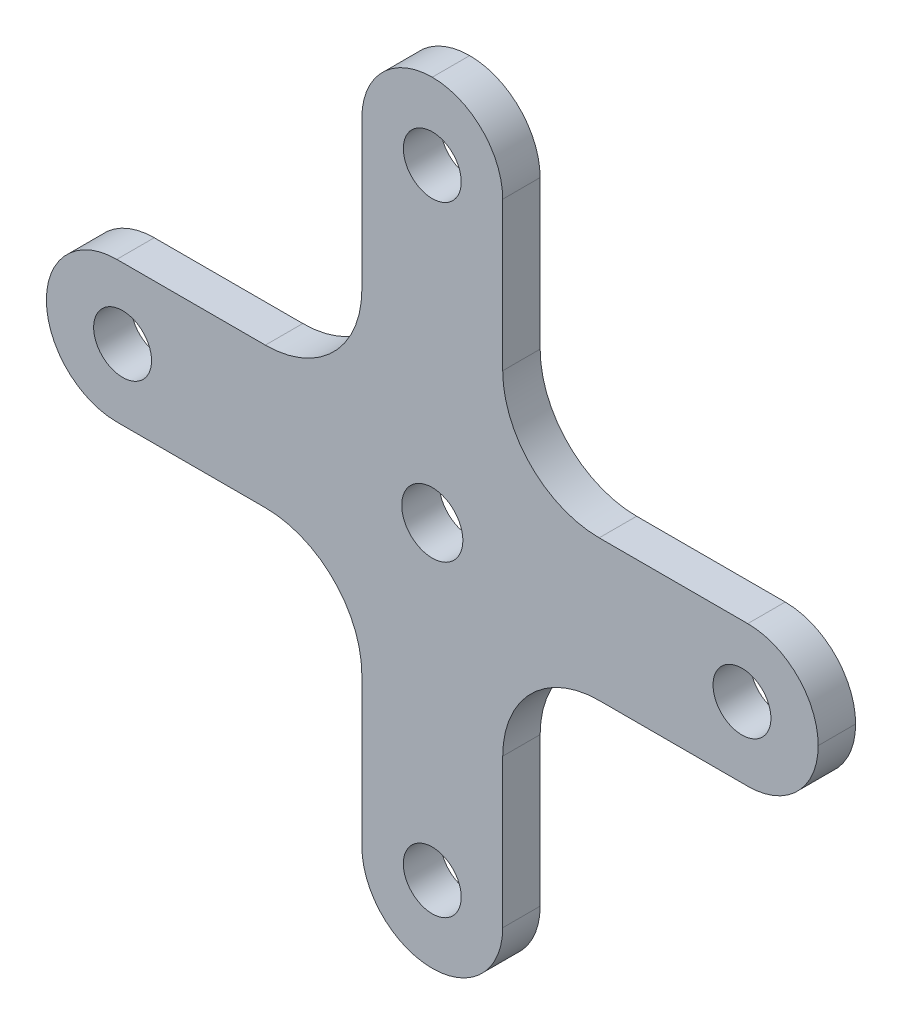
from build123d import *

# Parameters (mm, degrees)
SKETCH2_R           = 1.5
BOSS_EXTRUDE1_DEPTH = 0.97
FILLET1_R           = 3.65
FILLET2_R           = 5
SKETCH3_R           = 1.585
CUT_EXTRUDE1_DEPTH  = 29.350724858


with BuildPart() as part:
    # Sketch2 → Boss-Extrude1 (new, symmetric)
    with BuildSketch(Plane.XY):
        Polygon((-3.65, -3.65), (-3.65, -20), (3.65, -20), (3.65, -3.65), (20, -3.65), (20, 3.65), (3.65, 3.65), (3.65, 20), (-3.65, 20), (-3.65, 3.65), (-20, 3.65), (-20, -3.65), align=None)
        with Locations((-16.05, 0)):
            Circle(SKETCH2_R, mode=Mode.SUBTRACT)
        with Locations((0, -16.05)):
            Circle(SKETCH2_R, mode=Mode.SUBTRACT)
        with Locations((16.05, 0)):
            Circle(SKETCH2_R, mode=Mode.SUBTRACT)
        with Locations((0, 16.05)):
            Circle(SKETCH2_R, mode=Mode.SUBTRACT)
    extrude(amount=BOSS_EXTRUDE1_DEPTH, both=True)

    # Fillet1
    fillet1_edges = [part.edges().sort_by_distance(p)[0] for p in [
        (20, 3.65, 0),
        (20, -3.65, 0),
        (3.65, -20, 0),
        (-3.65, -20, 0),
        (-20, -3.65, 0),
        (-20, 3.65, 0),
        (3.65, 20, 0),
        (-3.65, 20, 0),
    ]]
    fillet(fillet1_edges, radius=FILLET1_R - 0.0001)  # a hair under: the kernel refuses the full size

    # Fillet2
    fillet2_edges = [part.edges().sort_by_distance(p)[0] for p in [
        (-3.65, -3.65, 0),
        (-3.65, 3.65, 0),
        (3.65, 3.65, 0),
        (3.65, -3.65, 0),
    ]]
    fillet(fillet2_edges, radius=FILLET2_R)

    # Sketch3 → Cut-Extrude1 (cut, through all)
    with BuildSketch(Plane.XY.offset(0.97)):
        Circle(SKETCH3_R)
    extrude(amount=-CUT_EXTRUDE1_DEPTH, mode=Mode.SUBTRACT)


solid = part.part
